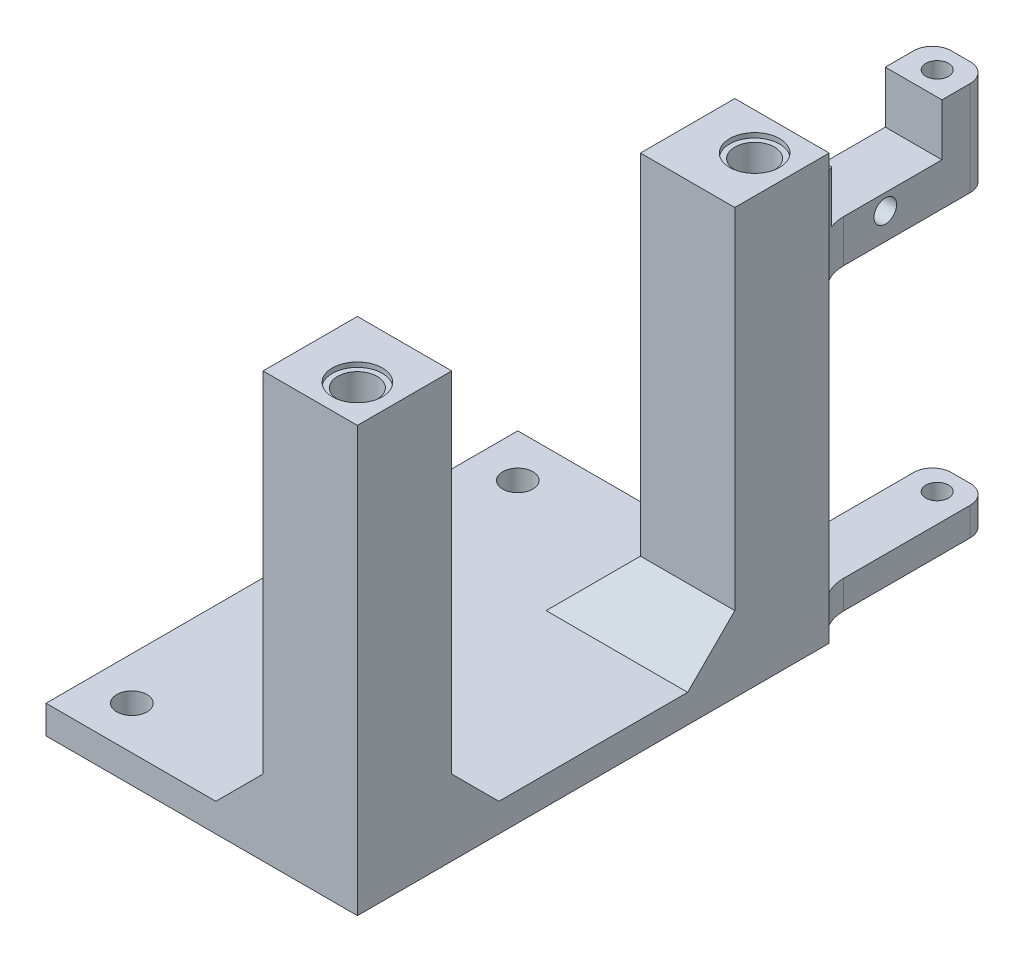
from build123d import *

# Parameters (mm, degrees)
SKETCH1_R           = 1.6
BOSS_EXTRUDE1_DEPTH = 3
SKETCH2_W           = 10
SKETCH2_H           = 10
BOSS_EXTRUDE2_DEPTH = 42
CHAMFER1_SIZE       = 5
SKETCH3_R           = 2.1
CUT_EXTRUDE1_DEPTH  = 52
SKETCH4_R           = 2.65
CUT_EXTRUDE2_DEPTH  = 0.5
SKETCH5_W           = 6
SKETCH5_H           = 4.513236852
BOSS_EXTRUDE3_DEPTH = 14.15
SKETCH6_R           = 1.2
CUT_EXTRUDE3_DEPTH  = 6
SKETCH7_W           = 6
SKETCH7_H           = 10.018921585
BOSS_EXTRUDE4_DEPTH = 5
SKETCH8_W           = 6.018924213
SKETCH8_H           = 5.505684733
BOSS_EXTRUDE5_DEPTH = 2.15
SKETCH9_W           = 6
SKETCH9_H           = 3
BOSS_EXTRUDE6_DEPTH = 19.15
SKETCH10_R          = 1.2
CUT_EXTRUDE4_DEPTH  = 64.766604599
FILLET3_R           = 2
FILLET4_R           = 4.25
FILLET5_R           = 4.25
FILLET6_R           = 4.25
FILLET7_R           = 4.25
FILLET8_START       = 17.362615229
FILLET8_DEPTH       = 7.820980384
FILLET8_START_2     = 14.037603206
FILLET8_2_DEPTH     = 12.4500001
FILLET8_START_3     = 3
FILLET8_3_DEPTH     = 2
FILLET9_R           = 1


with BuildPart() as part:
    # Sketch1 → Boss-Extrude1 (new body)
    with BuildSketch(Plane(origin=(0, 0, 0), x_dir=(1, 0, 0), z_dir=(0, 1, 0))):
        Polygon((-6.512396694, 9.685950413), (1.487603306, 9.685950413), (26.487603306, 9.685950413), (26.487603306, -40.314049587), (1.487603306, -40.314049587), (-6.512396694, -40.314049587), align=None)
        with Locations(Location((-1.962396694, -35.764049587, 0), (0, 0, 270))):
            Circle(SKETCH1_R, mode=Mode.SUBTRACT)
        with Locations(Location((-1.962396694, 5.135950413, 0), (0, 0, 270))):
            Circle(SKETCH1_R, mode=Mode.SUBTRACT)
    extrude(amount=BOSS_EXTRUDE1_DEPTH)

    # Sketch2 → Boss-Extrude2 (add)
    with BuildSketch(Plane(origin=(0, 3, 0), x_dir=(1, 0, 0), z_dir=(0, 1, 0))):
        with Locations((21.487603306, -35.314049587)):
            Rectangle(SKETCH2_W, SKETCH2_H)
        with Locations((21.487603306, 4.685950413)):
            Rectangle(SKETCH2_W, SKETCH2_H)
    extrude(amount=BOSS_EXTRUDE2_DEPTH)

    # Chamfer1
    chamfer1_edges = [part.edges().sort_by_distance(p)[0] for p in [
        (21.487603306, 3, 30.314049587),
        (16.487603306, 3, 35.314049587),
        (16.487603306, 3, -4.685950413),
        (21.487603306, 3, 0.314049587),
    ]]
    chamfer(chamfer1_edges, length=CHAMFER1_SIZE)

    # Sketch3 → Cut-Extrude1 (cut)
    with BuildSketch(Plane(origin=(0, 45, 0), x_dir=(1, 0, 0), z_dir=(0, 1, 0))):
        with Locations(Location((22.537603306, -36.364049587, 0), (0, 0, 270))):
            Circle(SKETCH3_R)
        with Locations(Location((22.537603306, 5.735950413, 0), (0, 0, 270))):
            Circle(SKETCH3_R)
    extrude(amount=-CUT_EXTRUDE1_DEPTH, mode=Mode.SUBTRACT)

    # Sketch4 → Cut-Extrude2 (cut)
    with BuildSketch(Plane(origin=(0, 45, 0), x_dir=(1, 0, 0), z_dir=(0, 1, 0))):
        with Locations(Location((22.537603306, -36.364049587, 0), (0, 0, 270))):
            Circle(SKETCH4_R)
        with Locations(Location((22.537603306, 5.735950413, 0), (0, 0, 270))):
            Circle(SKETCH4_R)
    cut_extrude2 = extrude(amount=-CUT_EXTRUDE2_DEPTH, mode=Mode.SUBTRACT)

    # Mirror1: Cut-Extrude2 across plane
    add(cut_extrude2.mirror(Plane(origin=(0, 22.5, 0), x_dir=(0, 0, 1), z_dir=(0, -1, 0))), mode=Mode.SUBTRACT)

    # Sketch5 → Boss-Extrude3 (add)
    with BuildSketch(Plane(origin=(0, 0, -9.685950413), x_dir=(-1, 0, 0), z_dir=(0, 0, -1))):
        with Locations((-21.287603306, 33.943381574)):
            Rectangle(SKETCH5_W, SKETCH5_H)
    extrude(amount=BOSS_EXTRUDE3_DEPTH)

    # Sketch6 → Cut-Extrude3 (cut)
    with BuildSketch(Plane(origin=(24.287603306, 0, 0), x_dir=(0, 0, -1), z_dir=(1, 0, 0))):
        with Locations(Location((17.835950413, 34.5, 0), (0, 0, 90))):
            Circle(SKETCH6_R)
    extrude(amount=-CUT_EXTRUDE3_DEPTH, mode=Mode.SUBTRACT)

    # Sketch7 → Boss-Extrude4 (add)
    with BuildSketch(Plane(origin=(0, 0, -23.835950413), x_dir=(-1, 0, 0), z_dir=(0, 0, -1))):
        with Locations((-21.287603306, 36.696223941)):
            Rectangle(SKETCH7_W, SKETCH7_H)
    extrude(amount=BOSS_EXTRUDE4_DEPTH)

    # Sketch8 → Boss-Extrude5 (add)
    with BuildSketch(Plane(origin=(0, 0, -9.685950413), x_dir=(-1, 0, 0), z_dir=(0, 0, -1))):
        with Locations((-21.278141199, 38.952842367)):
            Rectangle(SKETCH8_W, SKETCH8_H)
    extrude(amount=BOSS_EXTRUDE5_DEPTH)

    # Sketch9 → Boss-Extrude6 (add)
    with BuildSketch(Plane(origin=(0, 0, -9.685950413), x_dir=(-1, 0, 0), z_dir=(0, 0, -1))):
        with Locations((-21.287603306, 1.5)):
            Rectangle(SKETCH9_W, SKETCH9_H)
    extrude(amount=BOSS_EXTRUDE6_DEPTH)

    # Sketch10 → Cut-Extrude4 (cut, through all)
    with BuildSketch(Plane(origin=(0, 41.705684733, 0), x_dir=(1, 0, 0), z_dir=(0, 1, 0))):
        with Locations(Location((21.287603306, 26.335950413, 0), (0, 0, 270))):
            Circle(SKETCH10_R)
    extrude(amount=-CUT_EXTRUDE4_DEPTH, mode=Mode.SUBTRACT)

    # Fillet3
    fillet3_edges = [part.edges().sort_by_distance(p)[0] for p in [
        (24.287603306, 36.696223941, -28.835950413),
        (18.287603306, 36.696223941, -28.835950413),
        (18.287603306, 1.5, -28.835950413),
        (24.287603306, 1.5, -28.835950413),
    ]]
    fillet(fillet3_edges, radius=FILLET3_R)

    # Fillet4
    # the kernel refuses this fillet: 4.25 mm, written as the material it adds along each edge
    with BuildSketch(Plane(origin=(24.287603306, 3, -9.685950413), x_dir=(0, 0, -1), z_dir=(0, -1, 0))) as fillet4_piece_1:
        with BuildLine():
            CenterArc((3.722902094, 4.25), FILLET4_R, 208.839189401, 61.160810599)
            Line((0, 2.2), (-0.074458042, 2.159))
            ThreePointArc((-0.074458042, 2.159), (-0.085, 1.1), (-0.085, 0))
            Line((-0.085, 0), (0, -0.085))
            Line((0, -0.085), (3.722902094, -0.085))
            Line((3.722902094, -0.085), (3.722902094, 0))
        make_face()
    extrude(amount=3)

    # Fillet5
    fillet5_edges = [part.edges().sort_by_distance(p)[0] for p in [
        (18.287603306, 1.5, -9.685950413),
    ]]
    fillet(fillet5_edges, radius=FILLET5_R)

    # Fillet6
    # the kernel refuses this fillet: 4.25 mm, written as the material it adds along each edge
    with BuildSketch(Plane(origin=(24.287603306, 31.686763148, -9.685950413), x_dir=(1, 0, 0), z_dir=(0, 1, 0))) as fillet6_piece_1_section:
        with BuildLine():
            CenterArc((4.25, 3.722902094), FILLET6_R, 180, 61.160810599)
            Line((0, 3.722902094), (-0.085, 3.722902094))
            Line((-0.085, 3.722902094), (-0.085, 0))
            Line((-0.085, 0), (0, -0.085))
            ThreePointArc((0, -0.085), (1.1, -0.085), (2.159, -0.074458042))
            Line((2.159, -0.074458042), (2.2, 0))
        make_face()
    fillet6_piece_1 = extrude(amount=10.018921585, mode=Mode.PRIVATE)
    fillet6_piece_1 = split(fillet6_piece_1, bisect_by=Plane(origin=(24.287603306, 31.686763148, -11.835950413), z_dir=(0, 0, 1)), keep=Keep.TOP, mode=Mode.PRIVATE)
    fillet6_piece_1 = split(fillet6_piece_1, bisect_by=Plane(origin=(24.287603306, 36.2, -9.685950413), z_dir=(0, -1, 0)), keep=Keep.TOP, mode=Mode.PRIVATE)
    add(fillet6_piece_1)
    with BuildSketch(Plane(origin=(24.287603306, 31.686763148, -9.685950413), x_dir=(1, 0, 0), z_dir=(0, 1, 0))) as fillet6_piece_2_section:
        with BuildLine():
            CenterArc((4.25, 3.722902094), FILLET6_R, 180, 61.160810599)
            Line((0, 3.722902094), (-0.085, 3.722902094))
            Line((-0.085, 3.722902094), (-0.085, 0))
            Line((-0.085, 0), (0, -0.085))
            ThreePointArc((0, -0.085), (1.1, -0.085), (2.159, -0.074458042))
            Line((2.159, -0.074458042), (2.2, 0))
        make_face()
    fillet6_piece_2 = extrude(amount=10.018921585, mode=Mode.PRIVATE)
    fillet6_piece_2 = split(fillet6_piece_2, bisect_by=Plane(origin=(24.287603306, 31.686763148, -11.835950413), z_dir=(0, 0, -1)), keep=Keep.TOP, mode=Mode.PRIVATE)
    fillet6_piece_2 = split(fillet6_piece_2, bisect_by=Plane(origin=(24.287603306, 36.2, -9.685950413), z_dir=(0, -1, 0)), keep=Keep.TOP, mode=Mode.PRIVATE)
    add(fillet6_piece_2)
    with BuildSketch(Plane(origin=(24.287603306, 31.686763148, -9.685950413), x_dir=(1, 0, 0), z_dir=(0, 1, 0))) as fillet6_piece_3_section:
        with BuildLine():
            CenterArc((4.25, 3.722902094), FILLET6_R, 180, 61.160810599)
            Line((0, 3.722902094), (-0.085, 3.722902094))
            Line((-0.085, 3.722902094), (-0.085, 0))
            Line((-0.085, 0), (0, -0.085))
            ThreePointArc((0, -0.085), (1.1, -0.085), (2.159, -0.074458042))
            Line((2.159, -0.074458042), (2.2, 0))
        make_face()
    fillet6_piece_3 = extrude(amount=10.018921585, mode=Mode.PRIVATE)
    fillet6_piece_3 = split(fillet6_piece_3, bisect_by=Plane(origin=(24.287603306, 31.686763148, -11.835950413), z_dir=(0, 0, 1)), keep=Keep.TOP, mode=Mode.PRIVATE)
    fillet6_piece_3 = split(fillet6_piece_3, bisect_by=Plane(origin=(24.287603306, 36.2, -9.685950413), z_dir=(0, 1, 0)), keep=Keep.TOP, mode=Mode.PRIVATE)
    add(fillet6_piece_3)

    # Fillet7
    # the kernel refuses this fillet: 4.25 mm, written as the material it adds along each edge
    with BuildSketch(Plane(origin=(18.287603306, 31.686763148, -9.685950413), x_dir=(0, 0, -1), z_dir=(0, 1, 0))) as fillet7_piece_1:
        with BuildLine():
            CenterArc((3.472751071, 4.25), FILLET7_R, 215.202683568, 54.797316432)
            Line((0, 1.8), (0, 0))
            Line((0, 0), (3.472751071, 0))
        make_face()
    extrude(amount=4.513236852)

    # Fillet8: read off the stored shape, not the designer's step
    # Fillet8 outline → Fillet8 (add)
    with BuildSketch(Plane.YZ.offset(FILLET8_START)):
        with BuildLine():
            ThreePointArc((3, -10.685950413), (3.292893219, -9.978843632), (4, -9.685950413))
            Line((4, -9.685950413), (3, -9.685950413))
            Line((3, -9.685950413), (3, -10.685950413))
        make_face()
    extrude(amount=FILLET8_DEPTH)

    # Fillet8 2 outline → Fillet8 2 (add)
    with BuildSketch(Plane.YZ.offset(FILLET8_START_2)):
        with BuildLine():
            ThreePointArc((3, -10.685950413), (3.292893219, -9.978843632), (4, -9.685950413))
            Line((4, -9.685950413), (3, -9.685950413))
            Line((3, -9.685950413), (3, -10.685950413))
        make_face()
    extrude(amount=FILLET8_2_DEPTH)

    # Fillet8 3 outline → Fillet8 3 (cut)
    with BuildSketch(Plane(origin=(0, 0, 0), x_dir=(1, 0, 0), z_dir=(0, 1, 0)).offset(FILLET8_START_3)):
        with BuildLine():
            ThreePointArc((25.274429362, 10.685950413), (25.834372953, 10.129363879), (26.487603306, 9.685950413))
            Line((26.487603306, 9.685950413), (26.487603306, 10.685950413))
            Line((26.487603306, 10.685950413), (25.274429362, 10.685950413))
        make_face()
        with BuildLine():
            Line((14.037603206, 10.685950413), (14.037603306, 9.685950413))
            ThreePointArc((14.037603306, 9.685950413), (15.495341279, 9.943770557), (16.776216093, 10.685950413))
            Line((16.776216093, 10.685950413), (14.037603206, 10.685950413))
        make_face()
    extrude(amount=FILLET8_3_DEPTH, mode=Mode.SUBTRACT)

    # Fillet9
    # the kernel refuses this fillet: 1 mm, written as the material it adds along each edge
    with BuildSketch(Plane(origin=(26.487603306, 31.686763148, -9.685950413), x_dir=(0, -1, 0), z_dir=(-1, 0, 0))) as fillet9_piece_1_section:
        with BuildLine():
            CenterArc((FILLET9_R, -FILLET9_R), FILLET9_R, 90, 90)
            Line((0, -FILLET9_R), (0, 0))
            Line((0, 0), (FILLET9_R, 0))
        make_face()
    fillet9_piece_1 = extrude(amount=10, mode=Mode.PRIVATE)
    fillet9_piece_1 = fillet9_piece_1 - Plane(origin=(14.037603306, 31.686763148, -13.158701484), x_dir=(0, 0, -1), z_dir=(0, -1, 0)) * Cylinder(4.25, 25, mode=Mode.PRIVATE)
    fillet9_piece_1 = fillet9_piece_1 - Plane(origin=(28.537603306, 31.686763148, -13.408852507), x_dir=(1, 0, 0), z_dir=(0, -1, 0)) * Cylinder(4.25, 25, mode=Mode.PRIVATE)
    add(fillet9_piece_1)


solid = part.part
